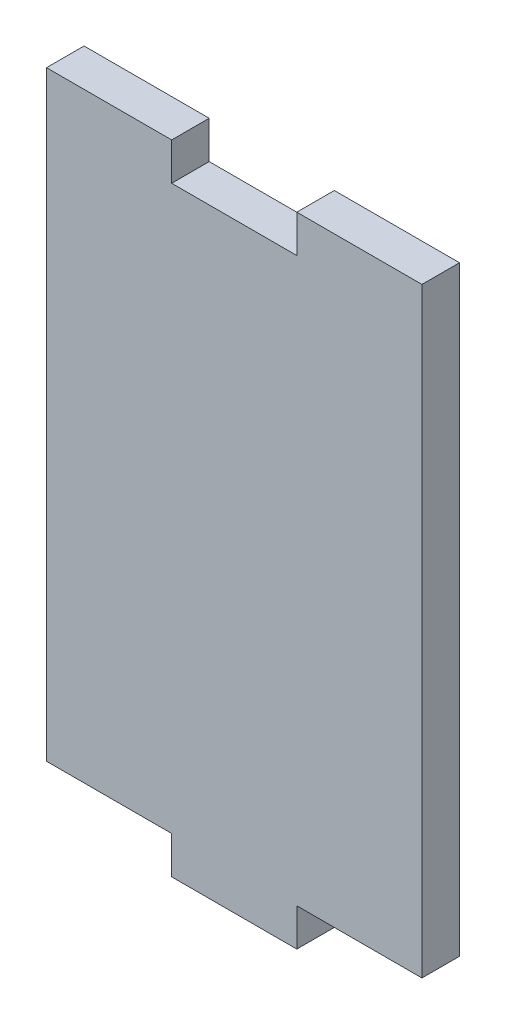
from build123d import *

# Parameters (mm, degrees)
BOSS_EXTRUDE1_DEPTH = 3


with BuildPart() as part:
    # Sketch1 → Boss-Extrude1 (new body)
    with BuildSketch(Plane.XY):
        Polygon((0, 0), (-10, 0), (-10, -3), (-20, -3), (-20, 0), (-30, 0), (-30, 48), (-20, 48), (-20, 45), (-10, 45), (-10, 48), (0, 48), align=None)
    extrude(amount=BOSS_EXTRUDE1_DEPTH)


solid = part.part
